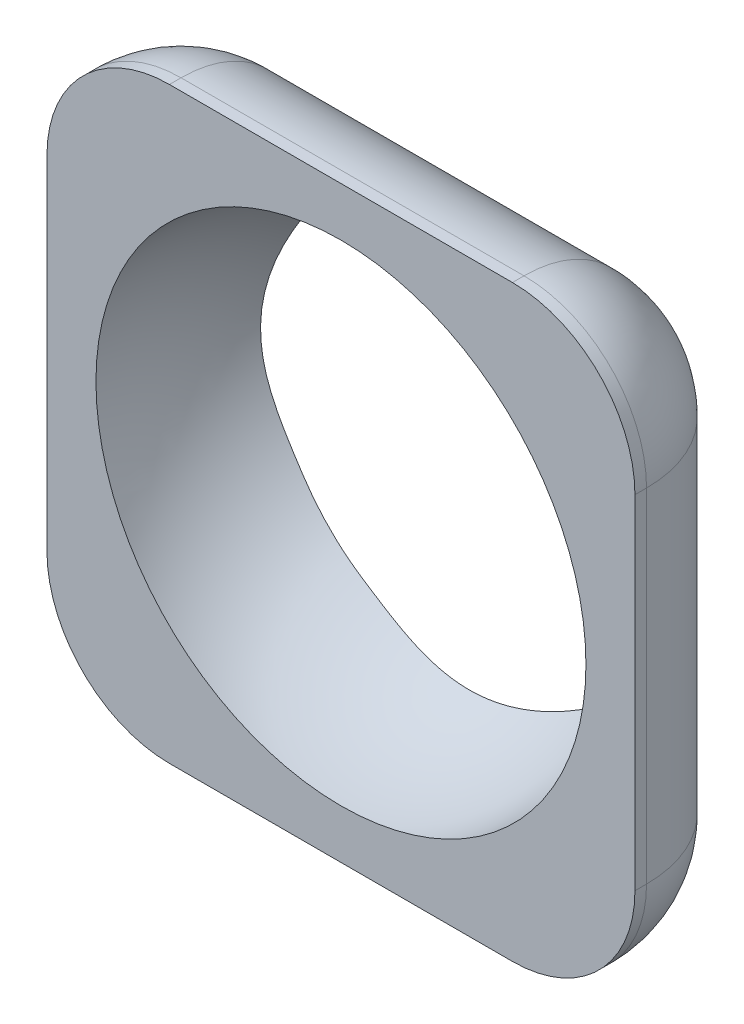
from build123d import *

# Parameters (mm, degrees)
SKETCH2_W           = 24
SKETCH2_H           = 24
BOSS_EXTRUDE1_DEPTH = 10.5
CUT_EXTRUDE1_DEPTH  = 36.528157847
FILLET1_R           = 5


with BuildPart() as part:
    # Sketch2 → Boss-Extrude1 (new body)
    with BuildSketch(Plane.XY):
        with Locations((12, 12)):
            Rectangle(SKETCH2_W, SKETCH2_H)
    extrude(amount=BOSS_EXTRUDE1_DEPTH)

    # Sketch4 → Cut-Revolve1 (revolve, cut)
    with BuildSketch(Plane.XY.offset(10.5)):
        with BuildLine():
            Line((12, 22), (12, 2))
            ThreePointArc((12, 2), (2, 12), (12, 22))
        make_face()
    revolve(axis=Axis((12, 22, 10.5), (0, -1, 0)), mode=Mode.SUBTRACT)

    # Sketch6 → Cut-Extrude1 (cut, through all)
    with BuildSketch(Plane(origin=(24, 0, 0), x_dir=(0, 0, -1), z_dir=(1, 0, 0))):
        Polygon((0, 24), (-3.026616613, 24), (-5.026616613, 24), (-5.026616613, 0), (-3.026616613, 0), (0, 0), align=None)
    extrude(amount=-CUT_EXTRUDE1_DEPTH, mode=Mode.SUBTRACT)

    # Fillet1
    # the kernel refuses this fillet: 5 mm, written as the material it takes off along each edge
    with BuildSketch(Plane(origin=(5, 19, 10.026616613), x_dir=(-1, 0, 0), z_dir=(0, 0, -1))) as fillet1_piece_1_section:
        Polygon((0, 0), (FILLET1_R, 0), (FILLET1_R, FILLET1_R), (0, FILLET1_R), align=None)
    fillet1_piece_1 = extrude(amount=FILLET1_R, mode=Mode.PRIVATE)
    fillet1_piece_1 = fillet1_piece_1 - Plane(origin=(5, 19, 10.026616613), x_dir=(0.7071067811865475, -0.7071067811865475, 0), z_dir=(0, 0, -1)) * Sphere(FILLET1_R, mode=Mode.PRIVATE)
    add(fillet1_piece_1, mode=Mode.SUBTRACT)
    with BuildSketch(Plane(origin=(5, 5, 10.026616613), x_dir=(0, 0, -1), z_dir=(0, -1, 0))) as fillet1_piece_2_section:
        Polygon((0, 0), (FILLET1_R, 0), (FILLET1_R, -FILLET1_R), (0, -FILLET1_R), align=None)
    fillet1_piece_2 = extrude(amount=FILLET1_R, mode=Mode.PRIVATE)
    fillet1_piece_2 = fillet1_piece_2 - Plane(origin=(5, 5, 10.026616613), x_dir=(0.7071067811865475, 0, 0.7071067811865475), z_dir=(0, -1, 0)) * Sphere(FILLET1_R, mode=Mode.PRIVATE)
    add(fillet1_piece_2, mode=Mode.SUBTRACT)
    with BuildSketch(Plane(origin=(19, 5, 10.026616613), x_dir=(0, 0, -1), z_dir=(0, -1, 0))) as fillet1_piece_3_section:
        Polygon((0, 0), (FILLET1_R, 0), (FILLET1_R, FILLET1_R), (0, FILLET1_R), align=None)
    fillet1_piece_3 = extrude(amount=FILLET1_R, mode=Mode.PRIVATE)
    fillet1_piece_3 = fillet1_piece_3 - Plane(origin=(19, 5, 10.026616613), x_dir=(-0.7071067811865475, 0, 0.7071067811865475), z_dir=(0, -1, 0)) * Sphere(FILLET1_R, mode=Mode.PRIVATE)
    add(fillet1_piece_3, mode=Mode.SUBTRACT)
    with BuildSketch(Plane(origin=(19, 19, 10.026616613), x_dir=(1, 0, 0), z_dir=(0, 0, -1))) as fillet1_piece_4_section:
        Polygon((0, 0), (FILLET1_R, 0), (FILLET1_R, -FILLET1_R), (0, -FILLET1_R), align=None)
    fillet1_piece_4 = extrude(amount=FILLET1_R, mode=Mode.PRIVATE)
    fillet1_piece_4 = fillet1_piece_4 - Plane(origin=(19, 19, 10.026616613), x_dir=(-0.7071067811865475, -0.7071067811865475, 0), z_dir=(0, 0, -1)) * Sphere(FILLET1_R, mode=Mode.PRIVATE)
    add(fillet1_piece_4, mode=Mode.SUBTRACT)
    with BuildSketch(Plane(origin=(0, 19, 5.026616613), x_dir=(1, 0, 0), z_dir=(0, -1, 0)), Plane(origin=(19, 0, 5.026616613), x_dir=(0, 0, 1), z_dir=(-1, 0, 0)), Plane(origin=(19, 24, 5.026616613), x_dir=(0, -1, 0), z_dir=(-1, 0, 0))) as fillet1_piece_5:
        with BuildLine():
            CenterArc((FILLET1_R, FILLET1_R), FILLET1_R, 180, 90)
            Line((0, FILLET1_R), (0, 0))
            Line((0, 0), (FILLET1_R, 0))
        make_face()
    extrude(amount=14, mode=Mode.SUBTRACT)
    with BuildSketch(Plane(origin=(24, 19, 5.026616613), x_dir=(-1, 0, 0), z_dir=(0, -1, 0))) as fillet1_piece_6:
        with BuildLine():
            CenterArc((FILLET1_R, -FILLET1_R), FILLET1_R, 90, 90)
            Line((0, -FILLET1_R), (0, 0))
            Line((0, 0), (FILLET1_R, 0))
        make_face()
    extrude(amount=14, mode=Mode.SUBTRACT)
    with BuildSketch(Plane(origin=(0, 24, 10.026616613), x_dir=(0, -1, 0), z_dir=(0, 0, 1)), Plane(origin=(0, 0, 10.026616613), x_dir=(1, 0, 0), z_dir=(0, 0, 1))) as fillet1_piece_7:
        with BuildLine():
            CenterArc((FILLET1_R, FILLET1_R), FILLET1_R, 180, 90)
            Line((0, FILLET1_R), (0, 0))
            Line((0, 0), (FILLET1_R, 0))
        make_face()
    extrude(amount=12.973383387, mode=Mode.SUBTRACT)
    with BuildSketch(Plane(origin=(24, 24, 10.026616613), x_dir=(0, -1, 0), z_dir=(0, 0, 1)), Plane(origin=(24, 0, 10.026616613), x_dir=(-1, 0, 0), z_dir=(0, 0, 1))) as fillet1_piece_8:
        with BuildLine():
            CenterArc((FILLET1_R, -FILLET1_R), FILLET1_R, 90, 90)
            Line((0, -FILLET1_R), (0, 0))
            Line((0, 0), (FILLET1_R, 0))
        make_face()
    extrude(amount=12.973383387, mode=Mode.SUBTRACT)


solid = part.part
